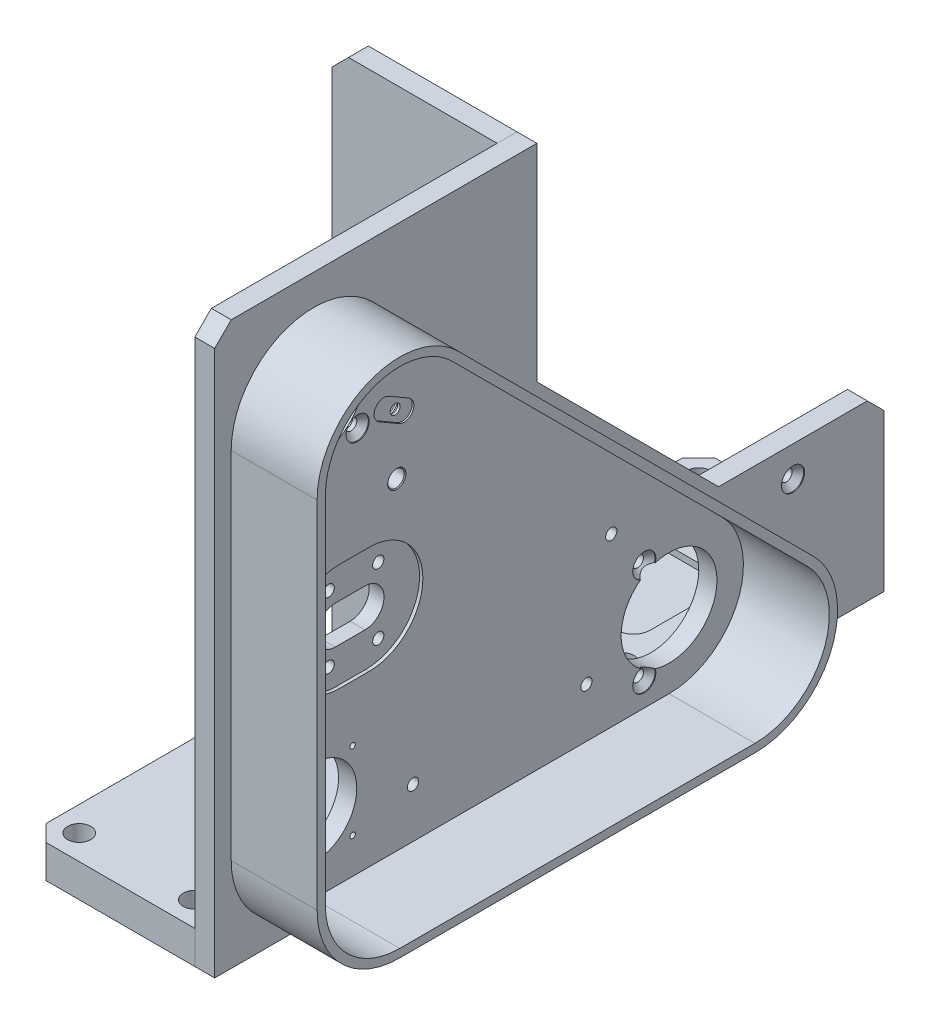
from build123d import *

# Parameters (mm, degrees)
SKETCH_1_W                  = 405
SKETCH_1_H                  = 340
SKETCH_1_R                  = 12
SKETCH_1_R_2                = 3.5
EXTRUDE_1_DEPTH             = 12
CUT_EXTRUDE_1_DEPTH         = 1
CUT_EXTRUDE_5_DEPTH         = 2
CUT_EXTRUDE_6_DEPTH         = 396.091445111
CUT_EXTRUDE_9_DEPTH         = 1
CUT_EXTRUDE_2_DEPTH         = 1
CUT_EXTRUDE_3_DEPTH         = 4.5
CUT_EXTRUDE_4_DEPTH         = 396.147124499
EXTRUDE_2_DEPTH             = 100
SKETCH_6_W                  = 12
SKETCH_6_H                  = 319
EXTRUDE_3_DEPTH             = 100
CUT_EXTRUDE_7_DEPTH         = 4
SKETCH_11_R                 = 30.5
SKETCH_11_R_2               = 3.5
CUT_EXTRUDE_8_DEPTH         = 409.81230412
EXTRUDE_4_DEPTH             = 52
CHAMFER_1_SIZE              = 10
CHAMFER_2_SIZE              = 10
CHAMFER_3_SIZE              = 10
CHAMFER_4_SIZE              = 10
SKETCH_14_R                 = 26
SKETCH_14_R_2               = 1
CUT_EXTRUDE_10_DEPTH        = 408.923093242
EXTRUDE_START               = 1
SKETCH_33_R                 = 1
SKETCH_33_R_2               = 26
EXTRUDE_5_DEPTH             = 1
SKETCH_16_W                 = 1.65
SKETCH_16_H                 = 112
HOLE_WIZARD_M4_1_AT_2_COUNT = 2
HOLE_WIZARD_M4_1_AT_2_PITCH = 47
HOLE_WIZARD_M4_1_AT_3_COUNT = 2
HOLE_WIZARD_M4_1_AT_3_PITCH = 66.468037432
HOLE_WIZARD_M4_1_AT_4_COUNT = 2
HOLE_WIZARD_M4_1_AT_4_PITCH = 47
SKETCH_17_R                 = 6.995
CUT_EXTRUDE_11_DEPTH        = 0.5
CHAMFER_6_SIZE              = 3.5
CUT_EXTRUDE_12_DEPTH        = 449.581096347
SKETCH_20_W                 = 3.4
SKETCH_20_H                 = 112
HOLE_WIZARD_M8_1_AT_2_COUNT = 2
HOLE_WIZARD_M8_1_AT_2_PITCH = 60.207972894
HOLE_WIZARD_M8_1_AT_3_COUNT = 2
HOLE_WIZARD_M8_1_AT_3_PITCH = 85
HOLE_WIZARD_M8_1_AT_4_COUNT = 2
HOLE_WIZARD_M8_1_AT_4_PITCH = 45
HOLE_WIZARD_M8_1_AT_5_COUNT = 2
HOLE_WIZARD_M8_1_AT_5_PITCH = 75
HOLE_WIZARD_M8_1_AT_6_COUNT = 2
HOLE_WIZARD_M8_1_AT_6_PITCH = 40
SKETCH_21_R                 = 29
CUT_EXTRUDE_13_DEPTH        = 411.537757094
SKETCH_22_R                 = 7
CUT_EXTRUDE_14_DEPTH        = 434.618495915
SKETCH_24_R                 = 13.5
CUT_EXTRUDE_15_DEPTH        = 12
GUSSET_START                = 130
GUSSET_1_DEPTH              = 8
SKETCH_27_W                 = 3.4
SKETCH_27_H                 = 112
HOLE_WIZARD_M8_2_AT_2_COUNT = 2
HOLE_WIZARD_M8_2_AT_2_PITCH = 183.575597507
HOLE_WIZARD_M8_2_AT_3_COUNT = 2
HOLE_WIZARD_M8_2_AT_3_PITCH = 108.166538264
HOLE_WIZARD_M8_2_AT_4_COUNT = 2
HOLE_WIZARD_M8_2_AT_4_PITCH = 139.539673009
HOLE_WIZARD_M8_2_AT_5_COUNT = 2
HOLE_WIZARD_M8_2_AT_5_PITCH = 105
CUT_EXTRUDE_16_DEPTH        = 1
SKETCH_30_R                 = 3
SKETCH_30_R_2               = 5
CUT_EXTRUDE_17_DEPTH        = 411.537757094
SKETCH_31_R                 = 6
CUT_EXTRUDE_18_DEPTH        = 1
CHAMFER_7_SIZE              = 3
CHAMFER_8_SIZE              = 0.5


# Read off the part's stored shape, not the designer's step: 角撑板1
# Some blends are built 0.0001 mm under size
with BuildPart() as part:
    # 草图1 → 凸台-拉伸1 (new body)
    with BuildSketch(Plane(origin=(0, 0, 0), x_dir=(0, 0, -1), z_dir=(1, 0, 0))):
        with Locations((-72.5, 113.5)):
            Rectangle(SKETCH_1_W, SKETCH_1_H)
        Circle(SKETCH_1_R, mode=Mode.SUBTRACT)
        with Locations((-215, 215)):
            Circle(SKETCH_1_R, mode=Mode.SUBTRACT)
        with Locations((-215, 0)):
            Circle(SKETCH_1_R, mode=Mode.SUBTRACT)
        with Locations((75, 30)):
            Circle(SKETCH_1_R_2, mode=Mode.SUBTRACT)
        with Locations((-15, 30)):
            Circle(SKETCH_1_R_2, mode=Mode.SUBTRACT)
        with Locations((-15, -30)):
            Circle(SKETCH_1_R_2, mode=Mode.SUBTRACT)
        with Locations((75, -30)):
            Circle(SKETCH_1_R_2, mode=Mode.SUBTRACT)
    extrude(amount=EXTRUDE_1_DEPTH)

    # 草图2 → 切除-拉伸1 (cut)
    with BuildSketch(Plane.ZY):
        with BuildLine():
            Line((150, 156.5), (259, 156.5))
            ThreePointArc((259, 156.5), (266.071067812, 159.428932188), (269, 166.5))
            Line((269, 166.5), (269, 263.5))
            ThreePointArc((269, 263.5), (266.071067812, 270.571067812), (259, 273.5))
            Line((259, 273.5), (150, 273.5))
            ThreePointArc((150, 273.5), (142.928932188, 270.571067812), (140, 263.5))
            Line((140, 263.5), (140, 166.5))
            ThreePointArc((140, 166.5), (142.928932188, 159.428932188), (150, 156.5))
        make_face()
        with BuildLine():
            Line((191.5, -33.5), (238.5, -33.5))
            ThreePointArc((238.5, -33.5), (245.571067812, -30.571067812), (248.5, -23.5))
            Line((248.5, -23.5), (248.5, 23.5))
            ThreePointArc((248.5, 23.5), (245.571067812, 30.571067812), (238.5, 33.5))
            Line((238.5, 33.5), (191.5, 33.5))
            ThreePointArc((191.5, 33.5), (184.428932188, 30.571067812), (181.5, 23.5))
            Line((181.5, 23.5), (181.5, -23.5))
            ThreePointArc((181.5, -23.5), (184.428932188, -30.571067812), (191.5, -33.5))
        make_face()
        with BuildLine():
            Line((-85, 43.5), (28, 43.5))
            ThreePointArc((28, 43.5), (35.071067812, 40.571067812), (38, 33.5))
            Line((38, 33.5), (38, -26.5))
            ThreePointArc((38, -26.5), (35.071067812, -33.571067812), (28, -36.5))
            Line((28, -36.5), (-85, -36.5))
            ThreePointArc((-85, -36.5), (-92.071067812, -33.571067812), (-95, -26.5))
            Line((-95, -26.5), (-95, 33.5))
            ThreePointArc((-95, 33.5), (-92.071067812, 40.571067812), (-85, 43.5))
        make_face()
    extrude(amount=-CUT_EXTRUDE_1_DEPTH, mode=Mode.SUBTRACT)

    # 草图8 → 切除-拉伸5 (cut)
    with BuildSketch(Plane(origin=(12, 0, 0), x_dir=(0, 0, -1), z_dir=(1, 0, 0))):
        with BuildLine():
            Line((-199.5, 122.5), (-181.5, 122.5))
            ThreePointArc((-181.5, 122.5), (-149, 90), (-181.5, 57.5))
            Line((-181.5, 57.5), (-199.5, 57.5))
            ThreePointArc((-199.5, 57.5), (-232, 90), (-199.5, 122.5))
        make_face()
    extrude(amount=-CUT_EXTRUDE_5_DEPTH, mode=Mode.SUBTRACT)

    # 草图9 → 切除-拉伸6 (cut, through all)
    with BuildSketch(Plane(origin=(10, 0, 0), x_dir=(0, 0, -1), z_dir=(1, 0, 0))):
        with BuildLine():
            Line((-200, 101.5), (-182, 101.5))
            ThreePointArc((-182, 101.5), (-170.5, 90), (-182, 78.5))
            Line((-182, 78.5), (-200, 78.5))
            ThreePointArc((-200, 78.5), (-211.5, 90), (-200, 101.5))
        make_face()
    extrude(amount=-CUT_EXTRUDE_6_DEPTH, mode=Mode.SUBTRACT)

    # 草图13 → 切除-拉伸9 (cut)
    with BuildSketch(Plane.ZY):
        with BuildLine():
            Line((143.5, 60), (258.5, 60))
            ThreePointArc((258.5, 60), (265.571067812, 62.928932188), (268.5, 70))
            Line((268.5, 70), (268.5, 110))
            ThreePointArc((268.5, 110), (265.571067812, 117.071067812), (258.5, 120))
            Line((258.5, 120), (143.5, 120))
            ThreePointArc((143.5, 120), (136.428932188, 117.071067812), (133.5, 110))
            Line((133.5, 110), (133.5, 70))
            ThreePointArc((133.5, 70), (136.428932188, 62.928932188), (143.5, 60))
        make_face()
    extrude(amount=-CUT_EXTRUDE_9_DEPTH, mode=Mode.SUBTRACT)

    # 草图3 → 切除-拉伸2 (cut)
    with BuildSketch(Plane.ZY.offset(-1)):
        with BuildLine():
            Line((248.5, -23.5), (248.5, 23.5))
            ThreePointArc((248.5, 23.5), (245.571067812, 30.571067812), (238.5, 33.5))
            Line((238.5, 33.5), (191.5, 33.5))
            ThreePointArc((191.5, 33.5), (184.428932188, 30.571067812), (181.5, 23.5))
            Line((181.5, 23.5), (181.5, -23.5))
            ThreePointArc((181.5, -23.5), (184.428932188, -30.571067812), (191.5, -33.5))
            Line((191.5, -33.5), (238.5, -33.5))
            ThreePointArc((238.5, -33.5), (245.571067812, -30.571067812), (248.5, -23.5))
        make_face()
    extrude(amount=-CUT_EXTRUDE_2_DEPTH, mode=Mode.SUBTRACT)

    # 草图4 → 切除-拉伸3 (cut)
    with BuildSketch(Plane.ZY.offset(-1)):
        with BuildLine():
            Line((269, 166.5), (269, 263.5))
            ThreePointArc((269, 263.5), (266.071067812, 270.571067812), (259, 273.5))
            Line((259, 273.5), (150, 273.5))
            ThreePointArc((150, 273.5), (142.928932188, 270.571067812), (140, 263.5))
            Line((140, 263.5), (140, 166.5))
            ThreePointArc((140, 166.5), (142.928932188, 159.428932188), (150, 156.5))
            Line((150, 156.5), (259, 156.5))
            ThreePointArc((259, 156.5), (266.071067812, 159.428932188), (269, 166.5))
        make_face()
    extrude(amount=-CUT_EXTRUDE_3_DEPTH, mode=Mode.SUBTRACT)

    # 草图5 → 切除-拉伸4 (cut, through all)
    with BuildSketch(Plane.ZY):
        Polygon((-130, 283.5), (80, 283.5), (80, 158.5), (-30, 48.5), (-130, 48.5), align=None)
    extrude(amount=-CUT_EXTRUDE_4_DEPTH, mode=Mode.SUBTRACT)

    # 草图11 → 切除-拉伸8 (cut, through all)
    with BuildSketch(Plane.ZY.offset(-5.5)):
        with Locations((215, 215)):
            Circle(SKETCH_11_R)
        with Locations((241.516504294, 241.516504294)):
            Circle(SKETCH_11_R_2)
        with Locations((188.483495706, 241.516504294)):
            Circle(SKETCH_11_R_2)
        with Locations((188.483495706, 188.483495706)):
            Circle(SKETCH_11_R_2)
        with Locations((241.516504294, 188.483495706)):
            Circle(SKETCH_11_R_2)
    extrude(amount=-CUT_EXTRUDE_8_DEPTH, mode=Mode.SUBTRACT)

    # 倒角1
    chamfer_1_edges = [part.edges().sort_by_distance(p)[0] for p in [
        (6, 48.5, -130),
    ]]
    chamfer(chamfer_1_edges, length=CHAMFER_1_SIZE)

    # 倒角2
    chamfer_2_edges = [part.edges().sort_by_distance(p)[0] for p in [
        (6, 283.5, 275),
    ]]
    chamfer(chamfer_2_edges, length=CHAMFER_2_SIZE)

    # 草图14 → 切除-拉伸10 (cut, through all)
    with BuildSketch(Plane.ZY.offset(-2)):
        with Locations((215, 0)):
            Circle(SKETCH_14_R)
        with Locations((238.6, 23.6)):
            Circle(SKETCH_14_R_2)
        with Locations((191.4, 23.6)):
            Circle(SKETCH_14_R_2)
        with Locations((191.4, -23.6)):
            Circle(SKETCH_14_R_2)
        with Locations((238.6, -23.6)):
            Circle(SKETCH_14_R_2)
    extrude(amount=-CUT_EXTRUDE_10_DEPTH, mode=Mode.SUBTRACT)

    # 草图33 → 凸台-拉伸5 (add)
    with BuildSketch(Plane.ZY.offset(-2).offset(EXTRUDE_START)):
        with BuildLine():
            Line((191.5, -33.5), (238.5, -33.5))
            ThreePointArc((238.5, -33.5), (245.571067812, -30.571067812), (248.5, -23.5))
            Line((248.5, -23.5), (248.5, 23.5))
            ThreePointArc((248.5, 23.5), (245.571067812, 30.571067812), (238.5, 33.5))
            Line((238.5, 33.5), (191.5, 33.5))
            ThreePointArc((191.5, 33.5), (184.428932188, 30.571067812), (181.5, 23.5))
            Line((181.5, 23.5), (181.5, -23.5))
            ThreePointArc((181.5, -23.5), (184.428932188, -30.571067812), (191.5, -33.5))
        make_face()
        with Locations((191.4, -23.6)):
            Circle(SKETCH_33_R, mode=Mode.SUBTRACT)
        with Locations((191.4, 23.6)):
            Circle(SKETCH_33_R, mode=Mode.SUBTRACT)
        with Locations((238.6, 23.6)):
            Circle(SKETCH_33_R, mode=Mode.SUBTRACT)
        with Locations((215, 0)):
            Circle(SKETCH_33_R_2, mode=Mode.SUBTRACT)
        with Locations((238.6, -23.6)):
            Circle(SKETCH_33_R, mode=Mode.SUBTRACT)
    extrude(amount=-EXTRUDE_5_DEPTH)

    # 草图16 → M4 螺纹孔1 (revolve, cut)
    with BuildSketch(Plane(origin=(12, 23.5, 191.5), x_dir=(0, 0, -1), z_dir=(0, 1, 0))):
        with Locations((0.825, 56)):
            Rectangle(SKETCH_16_W, SKETCH_16_H)
    hole_wizard_m4_1 = revolve(axis=Axis((18.35, 23.5, 191.5), (-1, 0, 0)), mode=Mode.SUBTRACT)

    # M4 螺纹孔1 at 2: M4 螺纹孔1 ×2
    with Locations(*[(0, 0, i * HOLE_WIZARD_M4_1_AT_2_PITCH) for i in range(1, HOLE_WIZARD_M4_1_AT_2_COUNT)]):
        add(hole_wizard_m4_1, mode=Mode.SUBTRACT)

    # M4 螺纹孔1 at 3: M4 螺纹孔1 ×2
    with Locations(*[Vector(0, -0.7071067811865476, 0.7071067811865476) * (i * HOLE_WIZARD_M4_1_AT_3_PITCH) for i in range(1, HOLE_WIZARD_M4_1_AT_3_COUNT)]):
        add(hole_wizard_m4_1, mode=Mode.SUBTRACT)

    # M4 螺纹孔1 at 4: M4 螺纹孔1 ×2
    with Locations(*[(0, -i * HOLE_WIZARD_M4_1_AT_4_PITCH, 0) for i in range(1, HOLE_WIZARD_M4_1_AT_4_COUNT)]):
        add(hole_wizard_m4_1, mode=Mode.SUBTRACT)

    # 草图17 → 切除-拉伸11 (cut)
    with BuildSketch(Plane(origin=(12, 0, 0), x_dir=(0, 0, -1), z_dir=(1, 0, 0))):
        with Locations((-241.516504294, 241.516504294)):
            Circle(SKETCH_17_R)
        with Locations((-188.483495706, 241.516504294)):
            Circle(SKETCH_17_R)
        with Locations((-188.483495706, 188.483495706)):
            Circle(SKETCH_17_R)
        with Locations((-241.516504294, 188.483495706)):
            Circle(SKETCH_17_R)
        with Locations((-15, 30)):
            Circle(SKETCH_17_R)
        with Locations((75, 30)):
            Circle(SKETCH_17_R)
        with Locations((75, -30)):
            Circle(SKETCH_17_R)
        with Locations((-15, -30)):
            Circle(SKETCH_17_R)
    extrude(amount=-CUT_EXTRUDE_11_DEPTH, mode=Mode.SUBTRACT)

    # 倒角6
    # the kernel refuses this chamfer: 3.5 mm, written as the material it takes off along each edge
    with BuildSketch(Plane(origin=(11.5, -30, 15), x_dir=(0, 0, -1), z_dir=(0, 1, 0))) as chamfer_6_piece_1_section:
        Polygon((3.5, CHAMFER_6_SIZE), (3.5 + CHAMFER_6_SIZE, 0), (3.5, 0), align=None)
    chamfer_6_piece_1 = revolve(axis=Axis((11.5, -30, 15), (-1, 0, 0)), mode=Mode.PRIVATE)
    chamfer_6_piece_1 = chamfer_6_piece_1 & Plane(origin=(9.739116456, -30, 15), x_dir=(0, 0, -1), z_dir=(1, 0, 0)) * Cylinder(6.995, 29, mode=Mode.PRIVATE)
    add(chamfer_6_piece_1, mode=Mode.SUBTRACT)
    with BuildSketch(Plane(origin=(11.5, -30, -75), x_dir=(0, 0, -1), z_dir=(0, 1, 0))) as chamfer_6_piece_2_section:
        Polygon((3.5, CHAMFER_6_SIZE), (3.5 + CHAMFER_6_SIZE, 0), (3.5, 0), align=None)
    chamfer_6_piece_2 = revolve(axis=Axis((11.5, -30, -75), (-1, 0, 0)), mode=Mode.PRIVATE)
    chamfer_6_piece_2 = chamfer_6_piece_2 & Plane(origin=(9.739116456, -30, -75), x_dir=(0, 0, -1), z_dir=(1, 0, 0)) * Cylinder(6.995, 29, mode=Mode.PRIVATE)
    add(chamfer_6_piece_2, mode=Mode.SUBTRACT)
    with BuildSketch(Plane(origin=(11.5, 30, -75), x_dir=(0, 0, -1), z_dir=(0, 1, 0))) as chamfer_6_piece_3_section:
        Polygon((3.5, CHAMFER_6_SIZE), (3.5 + CHAMFER_6_SIZE, 0), (3.5, 0), align=None)
    chamfer_6_piece_3 = revolve(axis=Axis((11.5, 30, -75), (-1, 0, 0)), mode=Mode.PRIVATE)
    chamfer_6_piece_3 = chamfer_6_piece_3 & Plane(origin=(9.739116456, 30, -75), x_dir=(0, 0, -1), z_dir=(1, 0, 0)) * Cylinder(6.995, 29, mode=Mode.PRIVATE)
    add(chamfer_6_piece_3, mode=Mode.SUBTRACT)
    with BuildSketch(Plane(origin=(11.5, 30, 15), x_dir=(0, 0, -1), z_dir=(0, 1, 0))) as chamfer_6_piece_4_section:
        Polygon((3.5, CHAMFER_6_SIZE), (3.5 + CHAMFER_6_SIZE, 0), (3.5, 0), align=None)
    chamfer_6_piece_4 = revolve(axis=Axis((11.5, 30, 15), (-1, 0, 0)), mode=Mode.PRIVATE)
    chamfer_6_piece_4 = chamfer_6_piece_4 & Plane(origin=(9.739116456, 30, 15), x_dir=(0, 0, -1), z_dir=(1, 0, 0)) * Cylinder(6.995, 28, mode=Mode.PRIVATE)
    add(chamfer_6_piece_4, mode=Mode.SUBTRACT)
    with BuildSketch(Plane(origin=(11.5, 188.483495706, 241.516504294), x_dir=(0, 0, 1), z_dir=(0, -1, 0))) as chamfer_6_piece_5_section:
        Polygon((3.5, CHAMFER_6_SIZE), (3.5 + CHAMFER_6_SIZE, 0), (3.5, 0), align=None)
    chamfer_6_piece_5 = revolve(axis=Axis((11.5, 188.483495706, 241.516504294), (-1, 0, 0)), mode=Mode.PRIVATE)
    chamfer_6_piece_5 = chamfer_6_piece_5 & Plane(origin=(9.739116456, 188.483495706, 241.516504294), x_dir=(0, 0, -1), z_dir=(1, 0, 0)) * Cylinder(6.995, 28, mode=Mode.PRIVATE)
    add(chamfer_6_piece_5, mode=Mode.SUBTRACT)
    with BuildSketch(Plane(origin=(11.5, 188.483495706, 188.483495706), x_dir=(0, 0, 1), z_dir=(0, -1, 0))) as chamfer_6_piece_6_section:
        Polygon((3.5, CHAMFER_6_SIZE), (3.5 + CHAMFER_6_SIZE, 0), (3.5, 0), align=None)
    chamfer_6_piece_6 = revolve(axis=Axis((11.5, 188.483495706, 188.483495706), (-1, 0, 0)), mode=Mode.PRIVATE)
    chamfer_6_piece_6 = chamfer_6_piece_6 & Plane(origin=(9.739116456, 188.483495706, 188.483495706), x_dir=(0, 0, -1), z_dir=(1, 0, 0)) * Cylinder(6.995, 28, mode=Mode.PRIVATE)
    add(chamfer_6_piece_6, mode=Mode.SUBTRACT)
    with BuildSketch(Plane(origin=(11.5, 241.516504294, 188.483495706), x_dir=(0, 0, 1), z_dir=(0, -1, 0))) as chamfer_6_piece_7_section:
        Polygon((3.5, CHAMFER_6_SIZE), (3.5 + CHAMFER_6_SIZE, 0), (3.5, 0), align=None)
    chamfer_6_piece_7 = revolve(axis=Axis((11.5, 241.516504294, 188.483495706), (-1, 0, 0)), mode=Mode.PRIVATE)
    chamfer_6_piece_7 = chamfer_6_piece_7 & Plane(origin=(9.739116456, 241.516504294, 188.483495706), x_dir=(0, 0, -1), z_dir=(1, 0, 0)) * Cylinder(6.995, 28, mode=Mode.PRIVATE)
    add(chamfer_6_piece_7, mode=Mode.SUBTRACT)
    with BuildSketch(Plane(origin=(11.5, 241.516504294, 241.516504294), x_dir=(0, 0, 1), z_dir=(0, -1, 0))) as chamfer_6_piece_8_section:
        Polygon((3.5, CHAMFER_6_SIZE), (3.5 + CHAMFER_6_SIZE, 0), (3.5, 0), align=None)
    chamfer_6_piece_8 = revolve(axis=Axis((11.5, 241.516504294, 241.516504294), (-1, 0, 0)), mode=Mode.PRIVATE)
    chamfer_6_piece_8 = chamfer_6_piece_8 & Plane(origin=(9.739116456, 241.516504294, 241.516504294), x_dir=(0, 0, -1), z_dir=(1, 0, 0)) * Cylinder(6.995, 28, mode=Mode.PRIVATE)
    add(chamfer_6_piece_8, mode=Mode.SUBTRACT)

    # 草图20 → M8 螺纹孔1 (revolve, cut)
    with BuildSketch(Plane(origin=(12, 70, 249), x_dir=(0, 0, -1), z_dir=(0, 1, 0))):
        with Locations((1.7, 56)):
            Rectangle(SKETCH_20_W, SKETCH_20_H)
    hole_wizard_m8_1 = revolve(axis=Axis((18.35, 70, 249), (-1, 0, 0)), mode=Mode.SUBTRACT)

    # M8 螺纹孔1 at 2: M8 螺纹孔1 ×2
    with Locations(*[Vector(0, 0.66436383882992, -0.7474093186836596) * (i * HOLE_WIZARD_M8_1_AT_2_PITCH) for i in range(1, HOLE_WIZARD_M8_1_AT_2_COUNT)]):
        add(hole_wizard_m8_1, mode=Mode.SUBTRACT)

    # M8 螺纹孔1 at 3: M8 螺纹孔1 ×2
    with Locations(*[Vector(0, 0.470588235294118, -0.8823529411764706) * (i * HOLE_WIZARD_M8_1_AT_3_PITCH) for i in range(1, HOLE_WIZARD_M8_1_AT_3_COUNT)]):
        add(hole_wizard_m8_1, mode=Mode.SUBTRACT)

    # M8 螺纹孔1 at 4: M8 螺纹孔1 ×2
    with Locations(*[(0, 0, -i * HOLE_WIZARD_M8_1_AT_4_PITCH) for i in range(1, HOLE_WIZARD_M8_1_AT_4_COUNT)]):
        add(hole_wizard_m8_1, mode=Mode.SUBTRACT)

    # M8 螺纹孔1 at 5: M8 螺纹孔1 ×2
    with Locations(*[(0, 0, -i * HOLE_WIZARD_M8_1_AT_5_PITCH) for i in range(1, HOLE_WIZARD_M8_1_AT_5_COUNT)]):
        add(hole_wizard_m8_1, mode=Mode.SUBTRACT)

    # M8 螺纹孔1 at 6: M8 螺纹孔1 ×2
    with Locations(*[(0, i * HOLE_WIZARD_M8_1_AT_6_PITCH, 0) for i in range(1, HOLE_WIZARD_M8_1_AT_6_COUNT)]):
        add(hole_wizard_m8_1, mode=Mode.SUBTRACT)

    # 草图21 → 切除-拉伸13 (cut, through all)
    with BuildSketch(Plane(origin=(12, 0, 0), x_dir=(0, 0, -1), z_dir=(1, 0, 0))):
        with Locations(Location((0, 0, 0), (0, 0, 253.221442081))):
            Circle(SKETCH_21_R)
    extrude(amount=-CUT_EXTRUDE_13_DEPTH, mode=Mode.SUBTRACT)

    # 草图27 → M8 螺纹孔2 (revolve, cut)
    with BuildSketch(Plane(origin=(12, -15, 155), x_dir=(0, 0, -1), z_dir=(0, 1, 0))):
        with Locations((1.7, 56)):
            Rectangle(SKETCH_27_W, SKETCH_27_H)
    hole_wizard_m8_2 = revolve(axis=Axis((18.35, -15, 155), (-1, 0, 0)), mode=Mode.SUBTRACT)

    # M8 螺纹孔2 at 2: M8 螺纹孔2 ×2
    with Locations(*[Vector(0, 0.8715755371245496, 0.49026123963255847) * (i * HOLE_WIZARD_M8_2_AT_2_PITCH) for i in range(1, HOLE_WIZARD_M8_2_AT_2_COUNT)]):
        add(hole_wizard_m8_2, mode=Mode.SUBTRACT)

    # M8 螺纹孔2 at 3: M8 螺纹孔2 ×2
    with Locations(*[Vector(0, 0.5547001962252297, 0.8320502943378433) * (i * HOLE_WIZARD_M8_2_AT_3_PITCH) for i in range(1, HOLE_WIZARD_M8_2_AT_3_COUNT)]):
        add(hole_wizard_m8_2, mode=Mode.SUBTRACT)

    # M8 螺纹孔2 at 4: M8 螺纹孔2 ×2
    with Locations(*[Vector(0, 0.5103437746397658, -0.859970483032084) * (i * HOLE_WIZARD_M8_2_AT_4_PITCH) for i in range(1, HOLE_WIZARD_M8_2_AT_4_COUNT)]):
        add(hole_wizard_m8_2, mode=Mode.SUBTRACT)

    # M8 螺纹孔2 at 5: M8 螺纹孔2 ×2
    with Locations(*[(0, 0, -i * HOLE_WIZARD_M8_2_AT_5_PITCH) for i in range(1, HOLE_WIZARD_M8_2_AT_5_COUNT)]):
        add(hole_wizard_m8_2, mode=Mode.SUBTRACT)

    # 草图29 → 切除-拉伸16 (cut)
    with BuildSketch(Plane(origin=(12, 0, 0), x_dir=(0, 0, -1), z_dir=(1, 0, 0))):
        with BuildLine():
            Line((-163.440399562, 178.303847577), (-175.564755215, 185.303847577))
            ThreePointArc((-175.564755215, 185.303847577), (-177.760907637, 193.5), (-169.564755215, 195.696152423))
            Line((-169.564755215, 195.696152423), (-157.440399562, 188.696152423))
            ThreePointArc((-157.440399562, 188.696152423), (-155.244247139, 180.5), (-163.440399562, 178.303847577))
        make_face()
    extrude(amount=-CUT_EXTRUDE_16_DEPTH, mode=Mode.SUBTRACT)

    # 草图30 → 切除-拉伸17 (cut, through all)
    with BuildSketch(Plane.ZY.offset(-12)):
        with Locations(Location((164.770526581, 186, 0), (0, 0, 180))):
            Circle(SKETCH_30_R)
        with Locations(Location((164.770526581, 150, 0), (0, 0, 180))):
            Circle(SKETCH_30_R_2)
    extrude(amount=CUT_EXTRUDE_17_DEPTH, mode=Mode.SUBTRACT)

    # 草图31 → 切除-拉伸18 (cut)
    with BuildSketch(Plane.ZY.offset(-5.5)):
        with Locations((164.770526581, 186)):
            Circle(SKETCH_31_R)
    extrude(amount=-CUT_EXTRUDE_18_DEPTH, mode=Mode.SUBTRACT)

    # 倒角7
    chamfer_7_edges = [part.edges().sort_by_distance(p)[0] for p in [
        (6.5, 186, 167.770526581),
    ]]
    chamfer(chamfer_7_edges, length=CHAMFER_7_SIZE - 0.0001)  # a hair under: the kernel refuses the full size

    # 倒角8
    chamfer_8_edges = [part.edges().sort_by_distance(p)[0] for p in [
        (12, 150, 169.770526581),
        (0, 150, 169.770526581),
    ]]
    chamfer(chamfer_8_edges, length=CHAMFER_8_SIZE)


with BuildPart() as body_2:
    # 草图7 → 凸台-拉伸2 (new body)
    with BuildSketch(Plane.ZY):
        with BuildLine():
            Line((-130, -56.5), (275, -56.5))
            Line((275, -56.5), (275, -36.5))
            Line((275, -36.5), (69.358898944, -36.5))
            ThreePointArc((69.358898944, -36.5), (67.236067977, -37.246794345), (65, -37.5))
            Line((65, -37.5), (-130, -37.5))
            Line((-130, -37.5), (-130, -56.5))
        make_face()
    extrude(amount=EXTRUDE_2_DEPTH)

    # 草图10 → 切除-拉伸7 (cut)
    with BuildSketch(Plane(origin=(0, -37.5, 0), x_dir=(1, 0, 0), z_dir=(0, 1, 0))):
        with BuildLine():
            Line((-69.5, 10), (-29.5, 10))
            ThreePointArc((-29.5, 10), (-22.428932188, 12.928932188), (-19.5, 20))
            Line((-19.5, 20), (-19.5, 60))
            ThreePointArc((-19.5, 60), (-22.428932188, 67.071067812), (-29.5, 70))
            Line((-29.5, 70), (-69.5, 70))
            ThreePointArc((-69.5, 70), (-76.571067812, 67.071067812), (-79.5, 60))
            Line((-79.5, 60), (-79.5, 20))
            ThreePointArc((-79.5, 20), (-76.571067812, 12.928932188), (-69.5, 10))
        make_face()
    extrude(amount=-CUT_EXTRUDE_7_DEPTH, mode=Mode.SUBTRACT)

    # 倒角4
    chamfer_4_edges = [body_2.edges().sort_by_distance(p)[0] for p in [
        (-100, -46.5, 275),
        (-100, -47, -130),
    ]]
    chamfer(chamfer_4_edges, length=CHAMFER_4_SIZE)

    # 草图18 → 切除-拉伸12 (cut, through all)
    with BuildSketch(Plane.XZ.offset(56.5)):
        with BuildLine():
            Line((-18, -85), (-18, -65))
            ThreePointArc((-18, -65), (-11, -58), (-4, -65))
            Line((-4, -65), (-4, -85))
            ThreePointArc((-4, -85), (-11, -92), (-18, -85))
        make_face()
        with BuildLine():
            Line((-18, 5), (-18, 25))
            ThreePointArc((-18, 25), (-11, 32), (-4, 25))
            Line((-4, 25), (-4, 5))
            ThreePointArc((-4, 5), (-11, -2), (-18, 5))
        make_face()
    extrude(amount=-CUT_EXTRUDE_12_DEPTH, mode=Mode.SUBTRACT)

    # 草图22 → 切除-拉伸14 (cut, through all)
    with BuildSketch(Plane(origin=(0, -36.5, 0), x_dir=(1, 0, 0), z_dir=(0, 1, 0))):
        with Locations(Location((-15, 115, 0), (0, 0, 270))):
            Circle(SKETCH_22_R)
        with Locations(Location((-85, 115, 0), (0, 0, 270))):
            Circle(SKETCH_22_R)
        with Locations(Location((-15, -260, 0), (0, 0, 270))):
            Circle(SKETCH_22_R)
        with Locations(Location((-85, -260, 0), (0, 0, 270))):
            Circle(SKETCH_22_R)
        with Locations(Location((-15, -115, 0), (0, 0, 270))):
            Circle(SKETCH_22_R)
        with Locations(Location((-85, -115, 0), (0, 0, 270))):
            Circle(SKETCH_22_R)
    extrude(amount=-CUT_EXTRUDE_14_DEPTH, mode=Mode.SUBTRACT)


with BuildPart() as body_3:
    # 草图6 → 凸台-拉伸3 (new body)
    with BuildSketch(Plane.ZY):
        with Locations((86, 124)):
            Rectangle(SKETCH_6_W, SKETCH_6_H)
    extrude(amount=EXTRUDE_3_DEPTH)

    # 倒角3
    chamfer_3_edges = [body_3.edges().sort_by_distance(p)[0] for p in [
        (-100, 283.5, 86),
    ]]
    chamfer(chamfer_3_edges, length=CHAMFER_3_SIZE)

    # 草图24 → 切除-拉伸15 (cut)
    with BuildSketch(Plane.XY.offset(92)):
        with Locations((-79.5, 78.5)):
            Circle(SKETCH_24_R)
        with Locations((-19.5, 78.5)):
            Circle(SKETCH_24_R)
    extrude(amount=-CUT_EXTRUDE_15_DEPTH, mode=Mode.SUBTRACT)


with BuildPart() as body_4:
    # 草图12 → 凸台-拉伸4 (new body)
    with BuildSketch(Plane(origin=(12, 0, 0), x_dir=(0, 0, -1), z_dir=(1, 0, 0))):
        with BuildLine():
            Line((-265, 215), (-265, 0))
            ThreePointArc((-265, 0), (-250.355339059, -35.355339059), (-215, -50))
            Line((-215, -50), (0, -50))
            ThreePointArc((0, -50), (46.193976626, -19.134171618), (35.355339059, 35.355339059))
            Line((35.355339059, 35.355339059), (-179.644660941, 250.355339059))
            ThreePointArc((-179.644660941, 250.355339059), (-234.134171618, 261.193976626), (-265, 215))
        make_face()
        with BuildLine():
            Line((-183.180194847, 246.819805153), (31.819805153, 31.819805153))
            ThreePointArc((31.819805153, 31.819805153), (41.574578963, -17.220754456), (0, -45))
            Line((0, -45), (-215, -45))
            ThreePointArc((-215, -45), (-246.819805153, -31.819805153), (-260, 0))
            Line((-260, 0), (-260, 215))
            ThreePointArc((-260, 215), (-232.220754456, 256.574578963), (-183.180194847, 246.819805153))
        make_face(mode=Mode.SUBTRACT)
    extrude(amount=EXTRUDE_4_DEPTH)


with BuildPart() as body_5:
    # Gusset 1 outline → Gusset 1 (new body)
    with BuildSketch(Plane(origin=(0, 0, 0), x_dir=(1, 0, 0), z_dir=(0, 1, 0)).offset(GUSSET_START)):
        Polygon((-15, -192), (0, -192), (0, -92), (-80, -92), (-80, -107), align=None)
    extrude(amount=GUSSET_1_DEPTH)


solid = Compound([part.part, body_2.part, body_3.part, body_4.part, body_5.part])
